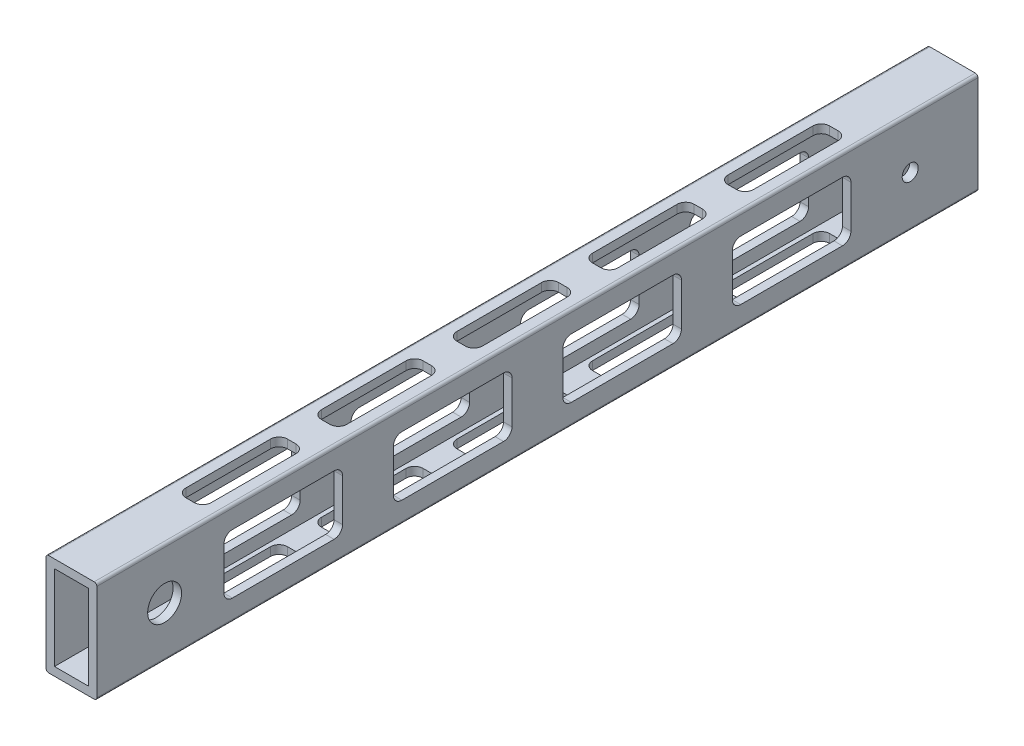
from build123d import *

# Parameters (mm, degrees)
SKETCH1_W               = 12.7
SKETCH1_H               = 31.75
BOSS_EXTRUDE1_DEPTH     = 165.1
CUT_EXTRUDE1_DEPTH      = 170.706645789
CUT_EXTRUDE1_DEPTH_BACK = 170.706645789
CUT_EXTRUDE2_DEPTH      = 168.283636378
CUT_EXTRUDE2_DEPTH_BACK = 168.283636378
CUT_EXTRUDE3_DEPTH      = 168.283636378
CUT_EXTRUDE3_DEPTH_BACK = 168.283636378
SKETCH4_R               = 6.35
SKETCH4_R_2             = 3


with BuildPart() as part:
    # Sketch1 → Boss-Extrude1 (new, symmetric)
    with BuildSketch(Plane.XY):
        with BuildLine():
            Line((-8.525, -19.05), (8.525, -19.05))
            ThreePointArc((8.525, -19.05), (9.232106781, -18.757106781), (9.525, -18.05))
            Line((9.525, -18.05), (9.525, 18.05))
            ThreePointArc((9.525, 18.05), (9.232106781, 18.757106781), (8.525, 19.05))
            Line((8.525, 19.05), (-8.525, 19.05))
            ThreePointArc((-8.525, 19.05), (-9.232106781, 18.757106781), (-9.525, 18.05))
            Line((-9.525, 18.05), (-9.525, -18.05))
            ThreePointArc((-9.525, -18.05), (-9.232106781, -18.757106781), (-8.525, -19.05))
        make_face()
        Rectangle(SKETCH1_W, SKETCH1_H, mode=Mode.SUBTRACT)
    extrude(amount=BOSS_EXTRUDE1_DEPTH, both=True)

    # Sketch2 → Cut-Extrude1 (cut, two sides: drawn at the far end of the back side and taken through both)
    with BuildSketch(Plane(origin=(0, 19.05, 0), x_dir=(1, 0, 0), z_dir=(0, 1, 0)).offset(-CUT_EXTRUDE1_DEPTH_BACK)):
        with BuildLine():
            Line((-4.7625, -66.675), (-4.7625, -34.925))
            ThreePointArc((-4.7625, -34.925), (-3.83256403, -32.67993597), (-1.5875, -31.75))
            Line((-1.5875, -31.75), (1.5875, -31.75))
            ThreePointArc((1.5875, -31.75), (3.83256403, -32.67993597), (4.7625, -34.925))
            Line((4.7625, -34.925), (4.7625, -66.675))
            ThreePointArc((4.7625, -66.675), (3.83256403, -68.92006403), (1.5875, -69.85))
            Line((1.5875, -69.85), (-1.5875, -69.85))
            ThreePointArc((-1.5875, -69.85), (-3.83256403, -68.92006403), (-4.7625, -66.675))
        make_face()
        with BuildLine():
            Line((-1.5875, -120.65), (1.5875, -120.65))
            ThreePointArc((1.5875, -120.65), (3.83256403, -119.72006403), (4.7625, -117.475))
            Line((4.7625, -117.475), (4.7625, -85.725))
            ThreePointArc((4.7625, -85.725), (3.83256403, -83.47993597), (1.5875, -82.55))
            Line((1.5875, -82.55), (-1.5875, -82.55))
            ThreePointArc((-1.5875, -82.55), (-3.83256403, -83.47993597), (-4.7625, -85.725))
            Line((-4.7625, -85.725), (-4.7625, -117.475))
            ThreePointArc((-4.7625, -117.475), (-3.83256403, -119.72006403), (-1.5875, -120.65))
        make_face()
        with BuildLine():
            Line((-4.7625, -15.875), (-4.7625, 15.875))
            ThreePointArc((-4.7625, 15.875), (-3.83256403, 18.12006403), (-1.5875, 19.05))
            Line((-1.5875, 19.05), (1.5875, 19.05))
            ThreePointArc((1.5875, 19.05), (3.83256403, 18.12006403), (4.7625, 15.875))
            Line((4.7625, 15.875), (4.7625, -15.875))
            ThreePointArc((4.7625, -15.875), (3.83256403, -18.12006403), (1.5875, -19.05))
            Line((1.5875, -19.05), (-1.5875, -19.05))
            ThreePointArc((-1.5875, -19.05), (-3.83256403, -18.12006403), (-4.7625, -15.875))
        make_face()
        with BuildLine():
            Line((-4.7625, 34.925), (-4.7625, 66.675))
            ThreePointArc((-4.7625, 66.675), (-3.83256403, 68.92006403), (-1.5875, 69.85))
            Line((-1.5875, 69.85), (1.5875, 69.85))
            ThreePointArc((1.5875, 69.85), (3.83256403, 68.92006403), (4.7625, 66.675))
            Line((4.7625, 66.675), (4.7625, 34.925))
            ThreePointArc((4.7625, 34.925), (3.83256403, 32.67993597), (1.5875, 31.75))
            Line((1.5875, 31.75), (-1.5875, 31.75))
            ThreePointArc((-1.5875, 31.75), (-3.83256403, 32.67993597), (-4.7625, 34.925))
        make_face()
        with BuildLine():
            Line((-4.7625, 85.725), (-4.7625, 117.475))
            ThreePointArc((-4.7625, 117.475), (-3.83256403, 119.72006403), (-1.5875, 120.65))
            Line((-1.5875, 120.65), (1.5875, 120.65))
            ThreePointArc((1.5875, 120.65), (3.83256403, 119.72006403), (4.7625, 117.475))
            Line((4.7625, 117.475), (4.7625, 85.725))
            ThreePointArc((4.7625, 85.725), (3.83256403, 83.47993597), (1.5875, 82.55))
            Line((1.5875, 82.55), (-1.5875, 82.55))
            ThreePointArc((-1.5875, 82.55), (-3.83256403, 83.47993597), (-4.7625, 85.725))
        make_face()
    extrude(amount=CUT_EXTRUDE1_DEPTH + CUT_EXTRUDE1_DEPTH_BACK, mode=Mode.SUBTRACT)

    # Sketch3 → Cut-Extrude2 (cut, two sides: drawn at the far end of the back side and taken through both)
    with BuildSketch(Plane(origin=(9.525, 0, 0), x_dir=(0, 0, -1), z_dir=(1, 0, 0)).offset(-CUT_EXTRUDE2_DEPTH_BACK)):
        with BuildLine():
            Line((-53.975, -7.9375), (-53.975, 7.9375))
            ThreePointArc((-53.975, 7.9375), (-53.04506403, 10.18256403), (-50.8, 11.1125))
            Line((-50.8, 11.1125), (-12.7, 11.1125))
            ThreePointArc((-12.7, 11.1125), (-10.45493597, 10.18256403), (-9.525, 7.9375))
            Line((-9.525, 7.9375), (-9.525, -7.9375))
            ThreePointArc((-9.525, -7.9375), (-10.45493597, -10.18256403), (-12.7, -11.1125))
            Line((-12.7, -11.1125), (-50.8, -11.1125))
            ThreePointArc((-50.8, -11.1125), (-53.04506403, -10.18256403), (-53.975, -7.9375))
        make_face()
        with BuildLine():
            Line((-114.3, -11.1125), (-76.2, -11.1125))
            ThreePointArc((-76.2, -11.1125), (-73.95493597, -10.18256403), (-73.025, -7.9375))
            Line((-73.025, -7.9375), (-73.025, 7.9375))
            ThreePointArc((-73.025, 7.9375), (-73.95493597, 10.18256403), (-76.2, 11.1125))
            Line((-76.2, 11.1125), (-114.3, 11.1125))
            ThreePointArc((-114.3, 11.1125), (-116.54506403, 10.18256403), (-117.475, 7.9375))
            Line((-117.475, 7.9375), (-117.475, -7.9375))
            ThreePointArc((-117.475, -7.9375), (-116.54506403, -10.18256403), (-114.3, -11.1125))
        make_face()
        with BuildLine():
            Line((9.525, -7.9375), (9.525, 7.9375))
            ThreePointArc((9.525, 7.9375), (10.45493597, 10.18256403), (12.7, 11.1125))
            Line((12.7, 11.1125), (50.8, 11.1125))
            ThreePointArc((50.8, 11.1125), (53.04506403, 10.18256403), (53.975, 7.9375))
            Line((53.975, 7.9375), (53.975, -7.9375))
            ThreePointArc((53.975, -7.9375), (53.04506403, -10.18256403), (50.8, -11.1125))
            Line((50.8, -11.1125), (12.7, -11.1125))
            ThreePointArc((12.7, -11.1125), (10.45493597, -10.18256403), (9.525, -7.9375))
        make_face()
        with BuildLine():
            Line((73.025, -7.9375), (73.025, 7.9375))
            ThreePointArc((73.025, 7.9375), (73.95493597, 10.18256403), (76.2, 11.1125))
            Line((76.2, 11.1125), (114.3, 11.1125))
            ThreePointArc((114.3, 11.1125), (116.54506403, 10.18256403), (117.475, 7.9375))
            Line((117.475, 7.9375), (117.475, -7.9375))
            ThreePointArc((117.475, -7.9375), (116.54506403, -10.18256403), (114.3, -11.1125))
            Line((114.3, -11.1125), (76.2, -11.1125))
            ThreePointArc((76.2, -11.1125), (73.95493597, -10.18256403), (73.025, -7.9375))
        make_face()
    extrude(amount=CUT_EXTRUDE2_DEPTH + CUT_EXTRUDE2_DEPTH_BACK, mode=Mode.SUBTRACT)

    # Sketch4 → Cut-Extrude3 (cut, two sides: drawn at the far end of the back side and taken through both)
    with BuildSketch(Plane(origin=(9.525, 0, 0), x_dir=(0, 0, -1), z_dir=(1, 0, 0)).offset(-CUT_EXTRUDE3_DEPTH_BACK)):
        with Locations((-139.7, 0)):
            Circle(SKETCH4_R)
        with Locations((139.7, 0)):
            Circle(SKETCH4_R_2)
    extrude(amount=CUT_EXTRUDE3_DEPTH + CUT_EXTRUDE3_DEPTH_BACK, mode=Mode.SUBTRACT)


solid = part.part
